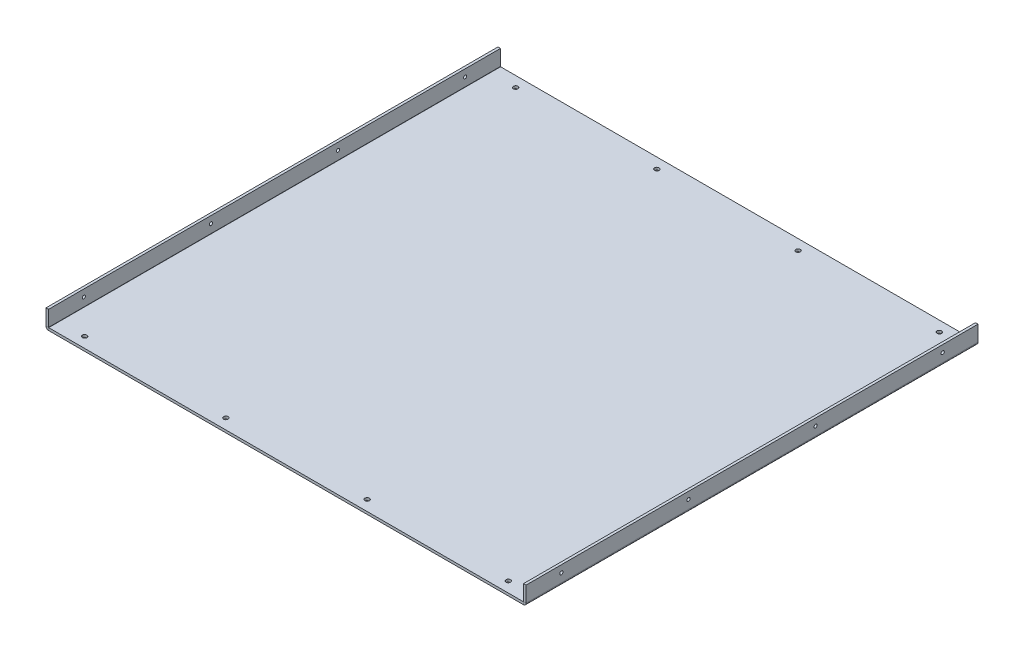
from build123d import *

# Parameters (mm, degrees)
BASE_FLANGE3_DEPTH = 406.4
SKETCH10_R         = 1.4478
CUT_EXTRUDE3_DEPTH = 594.198769469
SKETCH11_R         = 2.032
CUT_EXTRUDE4_DEPTH = 594.139546967


# Sheet-metal steps are written as plain solids
with BuildPart() as part:
    # Sketch1 → Base-Flange3 (new body)
    with BuildSketch(Plane.XY):
        with BuildLine():
            Line((431.8, 16.51), (431.8, 2.4384))
            ThreePointArc((431.8, 2.4384), (431.085809175, 0.714190825), (429.3616, 0))
            Line((429.3616, 0), (2.4384, 0))
            ThreePointArc((2.4384, 0), (0.714190825, 0.714190825), (0, 2.4384))
            Line((0, 2.4384), (0, 16.51))
            Line((0, 16.51), (2.286, 16.51))
            Line((2.286, 16.51), (2.286, 2.4384))
            ThreePointArc((2.286, 2.4384), (2.330636927, 2.330636927), (2.4384, 2.286))
            Line((2.4384, 2.286), (429.3616, 2.286))
            ThreePointArc((429.3616, 2.286), (429.469363073, 2.330636927), (429.514, 2.4384))
            Line((429.514, 2.4384), (429.514, 16.51))
            Line((429.514, 16.51), (431.8, 16.51))
        make_face()
    extrude(amount=BASE_FLANGE3_DEPTH)

    # Sketch10 → Cut-Extrude3 (cut, through all)
    with BuildSketch(Plane(origin=(431.8, 0, 0), x_dir=(0, 0, -1), z_dir=(1, 0, 0))):
        with Locations((-31.75, 10.16)):
            Circle(SKETCH10_R)
        with Locations((-146.05, 10.16)):
            Circle(SKETCH10_R)
        with Locations((-260.35, 10.16)):
            Circle(SKETCH10_R)
        with Locations((-374.65, 10.16)):
            Circle(SKETCH10_R)
    extrude(amount=-CUT_EXTRUDE3_DEPTH, mode=Mode.SUBTRACT)

    # Sketch11 → Cut-Extrude4 (cut, through all)
    with BuildSketch(Plane(origin=(0, 2.286, 0), x_dir=(-1, 0, 0), z_dir=(0, 1, 0))):
        with Locations(Location((-406.4, 397.002, 0), (0, 0, 90))):
            Circle(SKETCH11_R)
        with Locations(Location((-279.4, 397.002, 0), (0, 0, 90))):
            Circle(SKETCH11_R)
        with Locations(Location((-152.4, 397.002, 0), (0, 0, 90))):
            Circle(SKETCH11_R)
        with Locations(Location((-25.4, 397.002, 0), (0, 0, 90))):
            Circle(SKETCH11_R)
        with Locations(Location((-406.4, 9.398, 0), (0, 0, 90))):
            Circle(SKETCH11_R)
        with Locations(Location((-279.4, 9.398, 0), (0, 0, 90))):
            Circle(SKETCH11_R)
        with Locations(Location((-152.4, 9.398, 0), (0, 0, 90))):
            Circle(SKETCH11_R)
        with Locations(Location((-25.4, 9.398, 0), (0, 0, 90))):
            Circle(SKETCH11_R)
    extrude(amount=-CUT_EXTRUDE4_DEPTH, mode=Mode.SUBTRACT)


solid = part.part
